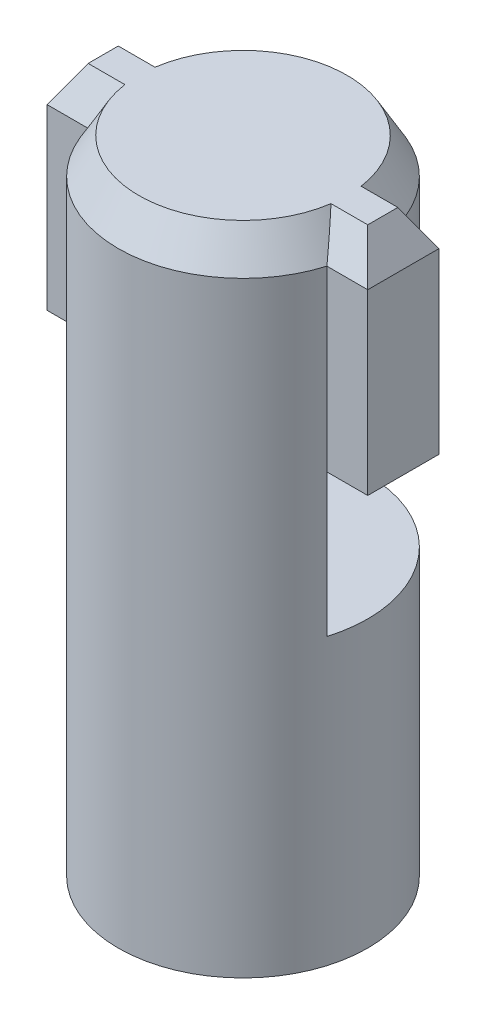
from build123d import *
from OCP.BRepFilletAPI import BRepFilletAPI_MakeChamfer

# Parameters (mm, degrees)
SKETCH1_R           = 3.5
BOSS_EXTRUDE1_DEPTH = 18
SKETCH2_W           = 9
SKETCH2_H           = 2
BOSS_EXTRUDE3_DEPTH = 10
CUT_EXTRUDE3_START  = -8
SKETCH3_W           = 10
SKETCH3_H           = 4.5
CUT_EXTRUDE3_DEPTH  = 4
CHAMFER1_SIZE       = 1
CHAMFER1_SIZE2      = 0.577350269


with BuildPart() as part:
    # Sketch1 → Boss-Extrude1 (new body)
    with BuildSketch(Plane(origin=(0, 0, 0), x_dir=(1, 0, 0), z_dir=(0, 1, 0))):
        Circle(SKETCH1_R)
    extrude(amount=BOSS_EXTRUDE1_DEPTH)

    # Sketch2 → Boss-Extrude3 (add)
    with BuildSketch(Plane(origin=(0, 18, 0), x_dir=(1, 0, 0), z_dir=(0, 1, 0))):
        Rectangle(SKETCH2_W, SKETCH2_H)
    extrude(amount=-BOSS_EXTRUDE3_DEPTH)

    # Sketch3 → Cut-Extrude3 (cut)
    with BuildSketch(Plane.XZ.offset(CUT_EXTRUDE3_START)):
        with Locations((0, -1.25)):
            Rectangle(SKETCH3_W, SKETCH3_H)
    extrude(amount=-CUT_EXTRUDE3_DEPTH, mode=Mode.SUBTRACT)

    # Chamfer1: one chamfer whose edges measure the first distance from different faces: ONE call of the kernel's chamfer builder (chamfer() names one face for all edges)
    chamfer1_edges_1 = [part.edges().sort_by_distance(p)[0] for p in [
        (-3.927050983, 18, 1),
    ]]
    chamfer1_side_1 = [part.faces().sort_by_distance(p)[0] for p in [
        (-3.927050983, 15, 1),
    ]]
    chamfer1_edges_2 = [part.edges().sort_by_distance(p)[0] for p in [
        (-4.5, 18, 0),
    ]]
    chamfer1_side_2 = [part.faces().sort_by_distance(p)[0] for p in [
        (-4.5, 15, 0),
    ]]
    chamfer1_edges_3 = [part.edges().sort_by_distance(p)[0] for p in [
        (-3.927050983, 18, -1),
    ]]
    chamfer1_side_3 = [part.faces().sort_by_distance(p)[0] for p in [
        (-3.927050983, 15, -1),
    ]]
    chamfer1_edges_4 = [part.edges().sort_by_distance(p)[0] for p in [
        (0, 18, -3.5),
    ]]
    chamfer1_side_4 = [part.faces().sort_by_distance(p)[0] for p in [
        (0, 15, -3.5),
    ]]
    chamfer1_edges_5 = [part.edges().sort_by_distance(p)[0] for p in [
        (3.927050983, 18, -1),
    ]]
    chamfer1_side_5 = [part.faces().sort_by_distance(p)[0] for p in [
        (3.927050983, 15, -1),
    ]]
    chamfer1_edges_6 = [part.edges().sort_by_distance(p)[0] for p in [
        (4.5, 18, 0),
    ]]
    chamfer1_side_6 = [part.faces().sort_by_distance(p)[0] for p in [
        (4.5, 15, 0),
    ]]
    chamfer1_edges_7 = [part.edges().sort_by_distance(p)[0] for p in [
        (3.927050983, 18, 1),
    ]]
    chamfer1_side_7 = [part.faces().sort_by_distance(p)[0] for p in [
        (3.927050983, 15, 1),
    ]]
    chamfer1_edges_8 = [part.edges().sort_by_distance(p)[0] for p in [
        (0, 18, 3.5),
    ]]
    chamfer1_side_8 = [part.faces().sort_by_distance(p)[0] for p in [
        (-3.5, 9, 0),
    ]]
    chamfer1 = BRepFilletAPI_MakeChamfer(part.part.solid().wrapped)
    for e in chamfer1_edges_1:
        chamfer1.Add(CHAMFER1_SIZE, CHAMFER1_SIZE2, e.wrapped, chamfer1_side_1[0].wrapped)  # the first distance lies on this face
    for e in chamfer1_edges_2:
        chamfer1.Add(CHAMFER1_SIZE, CHAMFER1_SIZE2, e.wrapped, chamfer1_side_2[0].wrapped)  # the first distance lies on this face
    for e in chamfer1_edges_3:
        chamfer1.Add(CHAMFER1_SIZE, CHAMFER1_SIZE2, e.wrapped, chamfer1_side_3[0].wrapped)  # the first distance lies on this face
    for e in chamfer1_edges_4:
        chamfer1.Add(CHAMFER1_SIZE, CHAMFER1_SIZE2, e.wrapped, chamfer1_side_4[0].wrapped)  # the first distance lies on this face
    for e in chamfer1_edges_5:
        chamfer1.Add(CHAMFER1_SIZE, CHAMFER1_SIZE2, e.wrapped, chamfer1_side_5[0].wrapped)  # the first distance lies on this face
    for e in chamfer1_edges_6:
        chamfer1.Add(CHAMFER1_SIZE, CHAMFER1_SIZE2, e.wrapped, chamfer1_side_6[0].wrapped)  # the first distance lies on this face
    for e in chamfer1_edges_7:
        chamfer1.Add(CHAMFER1_SIZE, CHAMFER1_SIZE2, e.wrapped, chamfer1_side_7[0].wrapped)  # the first distance lies on this face
    for e in chamfer1_edges_8:
        chamfer1.Add(CHAMFER1_SIZE, CHAMFER1_SIZE2, e.wrapped, chamfer1_side_8[0].wrapped)  # the first distance lies on this face
    add(Compound.cast(chamfer1.Shape()), mode=Mode.REPLACE)


solid = part.part
